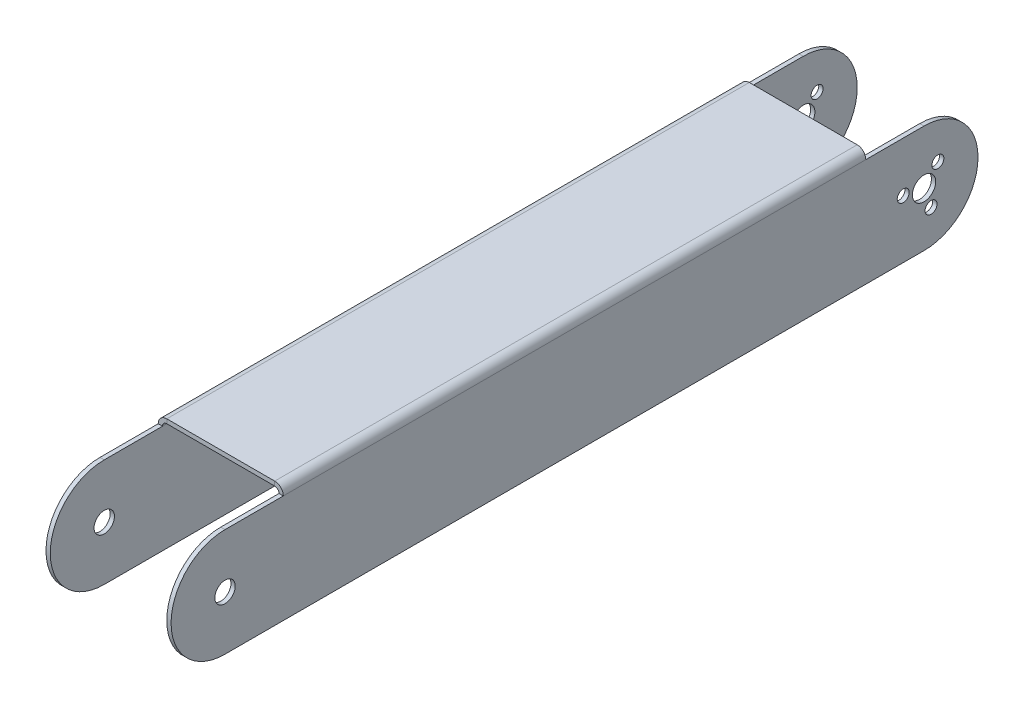
from build123d import *

# Parameters (mm, degrees)
SKETCH1_W                    = 18
SKETCH1_H                    = 100
BASE_FLANGE1_DEPTH           = 0.7366
EDGE_FLANGE1_DEPTH           = 100
EDGE_FLANGE1_BEND_DEPTH      = 100
SKETCH12_R                   = 2
TAB1_DEPTH                   = 0.7366
SKETCH15_R                   = 1.75
TAB2_DEPTH                   = 0.7366
F_2_05_2_05_DIAMETER_HOLE1_D = 2.05


# Sheet-metal steps are written as plain solids
with BuildPart() as part:
    # Sketch1 → Base-Flange1 (new body)
    with BuildSketch(Plane(origin=(0, 0, 0), x_dir=(1, 0, 0), z_dir=(0, 1, 0))):
        Rectangle(SKETCH1_W, SKETCH1_H)
    extrude(amount=-BASE_FLANGE1_DEPTH)

    # Edge-Flange1 section (across the edge) → Edge-Flange1 (add)
    with BuildSketch(Plane(origin=(10, -0.7366, -50), x_dir=(-1, 0, 0), z_dir=(0, 0, 1))):
        with BuildLine():
            Line((-0.7366, 0.7366), (-0.7366, 19.2634))
            Line((-0.7366, 19.2634), (0, 19.2634))
            Line((0, 19.2634), (0, 0.7366))
            ThreePointArc((0, 0.7366), (0.215745145, 0.215745145), (0.7366, 0))
            Line((0.7366, 0), (1, 0))
            Line((1, 0), (1, -0.7366))
            Line((1, -0.7366), (0.7366, -0.7366))
            ThreePointArc((0.7366, -0.7366), (-0.30510971, -0.30510971), (-0.7366, 0.7366))
        make_face()
    extrude(amount=EDGE_FLANGE1_DEPTH)

    # Edge-Flange1 section 2 (across the edge) → Edge-Flange1 bend (add)
    with BuildSketch(Plane(origin=(-10, -0.7366, 50), x_dir=(1, 0, 0), z_dir=(0, 0, -1))):
        with BuildLine():
            Line((-0.7366, 0.7366), (-0.7366, 19.2634))
            Line((-0.7366, 19.2634), (0, 19.2634))
            Line((0, 19.2634), (0, 0.7366))
            ThreePointArc((0, 0.7366), (0.215745145, 0.215745145), (0.7366, 0))
            Line((0.7366, 0), (1, 0))
            Line((1, 0), (1, -0.7366))
            Line((1, -0.7366), (0.7366, -0.7366))
            ThreePointArc((0.7366, -0.7366), (-0.30510971, -0.30510971), (-0.7366, 0.7366))
        make_face()
    extrude(amount=EDGE_FLANGE1_BEND_DEPTH)

    # Sketch12 → Tab1 (add)
    with BuildSketch(Plane.ZY.offset(10.7366)):
        with BuildLine():
            Line((-50, -1.4732), (-50, -20))
            Line((-50, -20), (-60, -20))
            ThreePointArc((-60, -20), (-69.2634, -10.7366), (-60, -1.4732))
            Line((-60, -1.4732), (-50, -1.4732))
        make_face()
        with Locations(Location((-60, -10.7366, 0), (0, 0, 270))):
            Circle(SKETCH12_R, mode=Mode.SUBTRACT)
    tab1 = extrude(amount=-TAB1_DEPTH)

    # Mirror1: Tab1 across plane
    add(tab1.mirror(Plane(origin=(0, 0, 0), x_dir=(0, 0, 1), z_dir=(1, 0, 0))))

    # Sketch15 → Tab2 (add)
    with BuildSketch(Plane(origin=(10.7366, 0, 0), x_dir=(0, 0, -1), z_dir=(1, 0, 0))):
        with BuildLine():
            Line((-50, -20), (-50, -1.4732))
            Line((-50, -1.4732), (-60, -1.4732))
            ThreePointArc((-60, -1.4732), (-69.2634, -10.7366), (-60, -20))
            Line((-60, -20), (-50, -20))
        make_face()
        with Locations(Location((-60, -10.7366, 0), (0, 0, 90))):
            Circle(SKETCH15_R, mode=Mode.SUBTRACT)
    tab2 = extrude(amount=-TAB2_DEPTH)

    # Mirror4: Tab2 across plane
    add(tab2.mirror(Plane(origin=(0, 0, 0), x_dir=(0, 0, 1), z_dir=(1, 0, 0))))

    # Ø2.05 (2.05) Diameter Hole1 (through all)
    with Locations(Plane(origin=(10.7366, -177.313180916, -73.74616676), x_dir=(0, 0.24782925197186137, -0.9688037272157182), z_dir=(1, 0, 0))):
        with Locations((24.667042937, 166.329840483), (30.950682453, 166.871449852), (28.277910167, 161.158853719)):
            Hole(F_2_05_2_05_DIAMETER_HOLE1_D / 2)


solid = part.part
